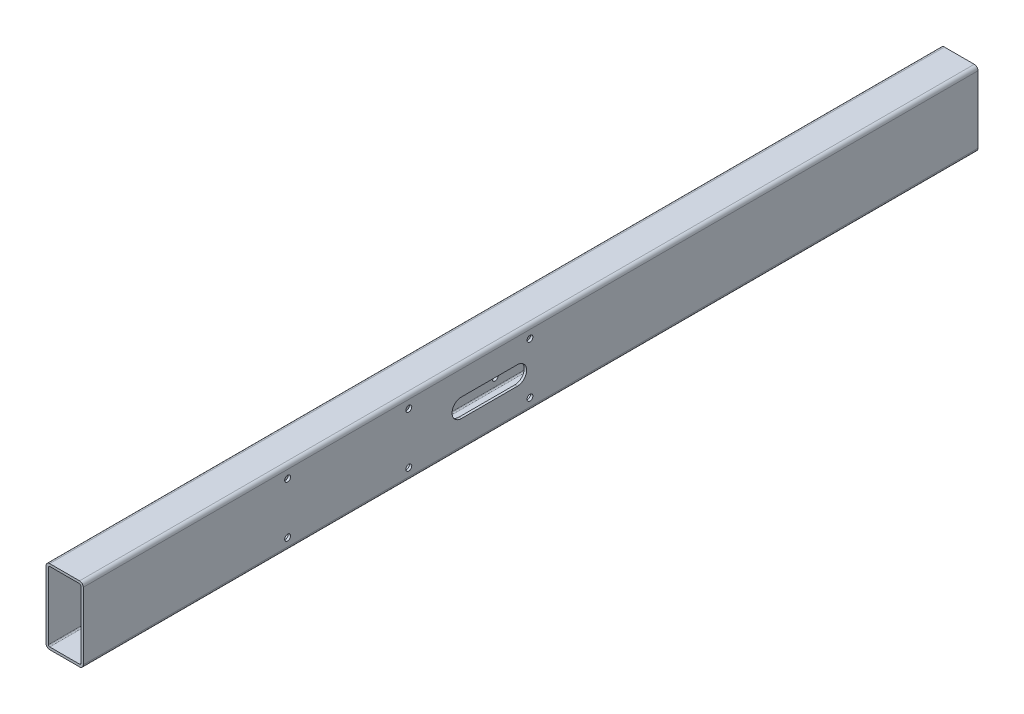
from build123d import *

# Parameters (mm, degrees)
EXTRUDE_THIN1_DEPTH = 304.8
CUT_EXTRUDE2_REACH  = 308.909
CUT_EXTRUDE4_REACH  = 308.909
SKETCH5_R           = 2.0193
CUT_EXTRUDE3_DEPTH  = 307.909367729


with BuildPart() as part:
    # Sketch1 → Extrude-Thin1 (new, symmetric)
    with BuildSketch(Plane.XY):
        with BuildLine():
            Line((-10.16, 25.4), (10.16, 25.4))
            ThreePointArc((10.16, 25.4), (11.956051224, 24.656051224), (12.7, 22.86))
            Line((12.7, 22.86), (12.7, -22.86))
            ThreePointArc((12.7, -22.86), (11.956051224, -24.656051224), (10.16, -25.4))
            Line((10.16, -25.4), (-10.16, -25.4))
            ThreePointArc((-10.16, -25.4), (-11.956051224, -24.656051224), (-12.7, -22.86))
            Line((-12.7, -22.86), (-12.7, 22.86))
            ThreePointArc((-12.7, 22.86), (-11.956051224, 24.656051224), (-10.16, 25.4))
        make_face()
        with BuildLine():
            Line((-10.16, 23.749), (10.16, 23.749))
            ThreePointArc((10.16, 23.749), (10.788617928, 23.488617928), (11.049, 22.86))
            Line((11.049, 22.86), (11.049, -22.86))
            ThreePointArc((11.049, -22.86), (10.788617928, -23.488617928), (10.16, -23.749))
            Line((10.16, -23.749), (-10.16, -23.749))
            ThreePointArc((-10.16, -23.749), (-10.788617928, -23.488617928), (-11.049, -22.86))
            Line((-11.049, -22.86), (-11.049, 22.86))
            ThreePointArc((-11.049, 22.86), (-10.788617928, 23.488617928), (-10.16, 23.749))
        make_face(mode=Mode.SUBTRACT)
    extrude(amount=EXTRUDE_THIN1_DEPTH, both=True)

    # Sketch3 → Cut-Extrude2 (cut, up to next)
    with BuildSketch(Plane.ZY.offset(12.7), mode=Mode.PRIVATE) as cut_extrude2_sk1:
        with BuildLine():
            Line((156.935953821, -2.5527), (9.085456927, -2.5527))
            ThreePointArc((9.085456927, -2.5527), (6.532756927, 0), (9.085456927, 2.5527))
            Line((9.085456927, 2.5527), (156.935953821, 2.5527))
            ThreePointArc((156.935953821, 2.5527), (159.488653821, 0), (156.935953821, -2.5527))
        make_face()
    cut_extrude2_tool1 = extrude(cut_extrude2_sk1.sketch, amount=-CUT_EXTRUDE2_REACH, mode=Mode.PRIVATE) & part.part
    add(cut_extrude2_tool1.solids().sort_by_distance((-12.7, 0, 83.010705))[0], mode=Mode.SUBTRACT)

    # Sketch6 → Cut-Extrude4 (cut, up to next)
    with BuildSketch(Plane(origin=(12.7, 0, 0), x_dir=(0, 0, -1), z_dir=(1, 0, 0)), mode=Mode.PRIVATE) as cut_extrude4_sk1:
        with BuildLine():
            Line((-47.185456927, 6.35), (-9.085456927, 6.35))
            ThreePointArc((-9.085456927, 6.35), (-2.735456927, 0), (-9.085456927, -6.35))
            Line((-9.085456927, -6.35), (-47.185456927, -6.35))
            ThreePointArc((-47.185456927, -6.35), (-53.535456927, 0), (-47.185456927, 6.35))
        make_face()
    cut_extrude4_tool1 = extrude(cut_extrude4_sk1.sketch, amount=-CUT_EXTRUDE4_REACH, mode=Mode.PRIVATE) & part.part
    add(cut_extrude4_tool1.solids().sort_by_distance((12.7, 0, 28.135457))[0], mode=Mode.SUBTRACT)

    # Sketch5 → Cut-Extrude3 (cut, through all)
    with BuildSketch(Plane(origin=(12.7, 0, 0), x_dir=(0, 0, -1), z_dir=(1, 0, 0))):
        with Locations((-0.460709127, 17.399)):
            Circle(SKETCH5_R)
        with Locations((-0.460709127, -17.399)):
            Circle(SKETCH5_R)
        with Locations((-83.010709127, 17.399)):
            Circle(SKETCH5_R)
        with Locations((-83.010709127, -17.399)):
            Circle(SKETCH5_R)
        with Locations((-165.560709127, -17.399)):
            Circle(SKETCH5_R)
        with Locations((-165.560709127, 17.399)):
            Circle(SKETCH5_R)
    extrude(amount=-CUT_EXTRUDE3_DEPTH, mode=Mode.SUBTRACT)


solid = part.part
